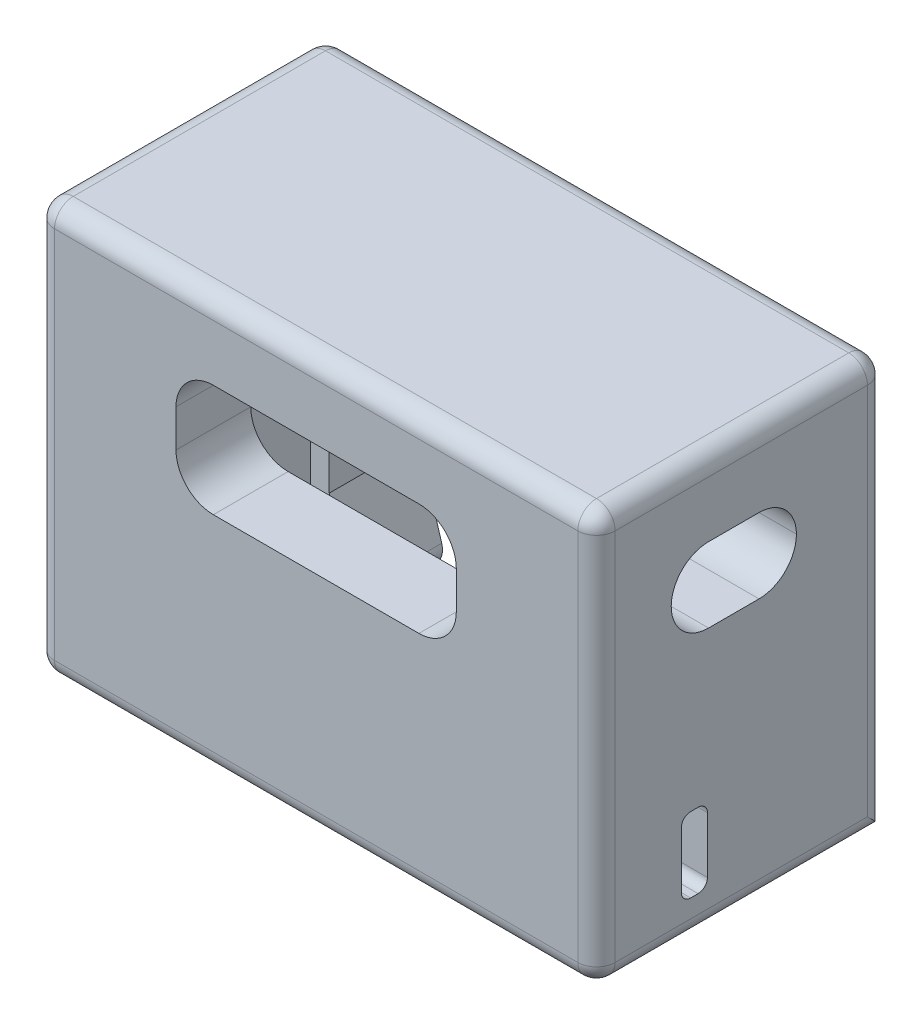
from build123d import *

# Parameters (mm, degrees)
SKETCH1_W           = 38.1
SKETCH1_H           = 6.096
BOSS_EXTRUDE1_DEPTH = 22.86
SKETCH4_W           = 25.4
SKETCH4_H           = 6.096
CUT_EXTRUDE1_DEPTH  = 15.875
FILLET1_R           = 1.27
SKETCH5_W           = 38.1
SKETCH5_H           = 19.685
BOSS_EXTRUDE2_DEPTH = 5.08
BOSS_EXTRUDE3_DEPTH = 6.096
BOSS_EXTRUDE4_DEPTH = 6.096
FILLET2_R           = 1.27
SKETCH9_W           = 38.1
SKETCH9_H           = 5.08
BOSS_EXTRUDE5_DEPTH = 22.86
SKETCH10_W          = 8.509
SKETCH10_H          = 17.78
BOSS_EXTRUDE6_DEPTH = 5.08
SKETCH11_W          = 8.509
SKETCH11_H          = 17.78
BOSS_EXTRUDE7_DEPTH = 5.08
SKETCH12_W          = 19.05
SKETCH12_H          = 7.62
CUT_EXTRUDE2_DEPTH  = 5.08
FILLET3_R           = 2.54
FILLET5_R           = 2.54
FILLET6_R           = 1.27
SKETCH13_W          = 13.940844751
SKETCH13_H          = 3.429
BOSS_EXTRUDE8_DEPTH = 1.524
CUT_EXTRUDE5_REACH  = 52.09
SKETCH22_W          = 1.778
SKETCH22_H          = 5.08
FILLET7_R           = 0.635


with BuildPart() as part:
    # Sketch1 → Boss-Extrude1 (new body)
    with BuildSketch(Plane(origin=(0, 0, 0), x_dir=(1, 0, 0), z_dir=(0, 1, 0))):
        Rectangle(SKETCH1_W, SKETCH1_H)
    extrude(amount=BOSS_EXTRUDE1_DEPTH)

    # Sketch4 → Cut-Extrude1 (cut)
    with BuildSketch(Plane.XZ):
        Rectangle(SKETCH4_W, SKETCH4_H)
    extrude(amount=-CUT_EXTRUDE1_DEPTH, mode=Mode.SUBTRACT)

    # Fillet1
    fillet1_edges = [part.edges().sort_by_distance(p)[0] for p in [
        (0, 15.875, -3.048),
    ]]
    fillet(fillet1_edges, radius=FILLET1_R)

    # Sketch5 → Boss-Extrude2 (add)
    with BuildSketch(Plane(origin=(0, 22.86, 0), x_dir=(1, 0, 0), z_dir=(0, 1, 0))):
        with Locations((0, -6.7945)):
            Rectangle(SKETCH5_W, SKETCH5_H)
    extrude(amount=BOSS_EXTRUDE2_DEPTH)

    # Sketch6 → Boss-Extrude3 (add)
    with BuildSketch(Plane.XY.offset(3.048)):
        Polygon((-12.7, 0), (-10.668, 0), (-12.7, 6.858), align=None)
    extrude(amount=-BOSS_EXTRUDE3_DEPTH)

    # Sketch7 → Boss-Extrude4 (add)
    with BuildSketch(Plane.XY.offset(3.048)):
        Polygon((12.7, 0), (10.668, 0), (12.7, 6.858), align=None)
    extrude(amount=-BOSS_EXTRUDE4_DEPTH)

    # Fillet2
    fillet2_edges = [part.edges().sort_by_distance(p)[0] for p in [
        (-10.668, 0, 0),
        (10.668, 0, 0),
    ]]
    fillet(fillet2_edges, radius=FILLET2_R)

    # Sketch9 → Boss-Extrude5 (add)
    with BuildSketch(Plane.XZ.offset(-22.86)):
        with Locations((0, 14.097)):
            Rectangle(SKETCH9_W, SKETCH9_H)
    extrude(amount=BOSS_EXTRUDE5_DEPTH)

    # Sketch10 → Boss-Extrude6 (add)
    with BuildSketch(Plane(origin=(19.05, 0, 0), x_dir=(0, 0, -1), z_dir=(1, 0, 0))):
        with Locations((-7.3025, 8.89)):
            Rectangle(SKETCH10_W, SKETCH10_H)
    extrude(amount=-BOSS_EXTRUDE6_DEPTH)

    # Sketch11 → Boss-Extrude7 (add)
    with BuildSketch(Plane.ZY.offset(19.05)):
        with Locations((7.3025, 8.89)):
            Rectangle(SKETCH11_W, SKETCH11_H)
    extrude(amount=-BOSS_EXTRUDE7_DEPTH)

    # Sketch12 → Cut-Extrude2 (cut)
    with BuildSketch(Plane.XY.offset(16.637)):
        with Locations((0, 19.05)):
            Rectangle(SKETCH12_W, SKETCH12_H)
    extrude(amount=-CUT_EXTRUDE2_DEPTH, mode=Mode.SUBTRACT)

    # Fillet3
    fillet3_edges = [part.edges().sort_by_distance(p)[0] for p in [
        (9.525, 22.86, 14.097),
        (9.525, 15.24, 14.097),
        (-9.525, 15.24, 14.097),
        (-9.525, 22.86, 14.097),
    ]]
    fillet(fillet3_edges, radius=FILLET3_R)

    # Fillet5
    fillet5_edges = [part.edges().sort_by_distance(p)[0] for p in [
        (13.0175, 22.86, 11.557),
        (16.51, 17.78, 11.557),
        (16.51, 17.78, 3.048),
        (0, 22.86, 3.048),
        (-13.0175, 22.86, 11.557),
        (-16.51, 17.78, 11.557),
        (-16.51, 17.78, 3.048),
    ]]
    fillet(fillet5_edges, radius=FILLET5_R - 0.0001)  # a hair under: the kernel refuses the full size

    # Fillet6
    fillet6_edges = [part.edges().sort_by_distance(p)[0] for p in [
        (19.05, 13.97, 16.637),
        (-19.05, 13.97, 16.637),
        (19.05, 27.94, 6.7945),
        (0, 27.94, -3.048),
        (-19.05, 27.94, 6.7945),
        (0, 27.94, 16.637),
        (-19.05, 0, 6.7945),
        (19.05, 0, 6.7945),
        (-19.05, 13.97, -3.048),
        (19.05, 13.97, -3.048),
        (0, 0, 16.637),
    ]]
    fillet(fillet6_edges, radius=FILLET6_R)

    # Sketch13 → Boss-Extrude8 (add)
    with BuildSketch(Plane.XZ.offset(-22.86)):
        with Locations((-0.014577624, 7.3025)):
            Rectangle(SKETCH13_W, SKETCH13_H)
    extrude(amount=BOSS_EXTRUDE8_DEPTH)

    # Cut-Extrude5: up to this face of the body (flat: up to its plane)
    cut_extrude5_end = Plane(part.part.faces().sort_by_distance((-19.05, 13.368385641, 6.746370851))[0])
    # Sketch22 → Cut-Extrude5 (cut, up to the picked face)
    with BuildSketch(Plane(origin=(19.05, 0, 0), x_dir=(0, 0, -1), z_dir=(1, 0, 0)), mode=Mode.PRIVATE) as cut_extrude5_sk1:
        with Locations((-9.982963742, 5.043439789)):
            Rectangle(SKETCH22_W, SKETCH22_H)
    cut_extrude5_tool1 = split(extrude(cut_extrude5_sk1.sketch, amount=-CUT_EXTRUDE5_REACH, mode=Mode.PRIVATE), bisect_by=cut_extrude5_end, keep=Keep.BOTH, mode=Mode.PRIVATE)
    add(cut_extrude5_tool1.solids().sort_by(Axis((19.05, 5.04344, 9.982964), (-1, 0, 0)))[0], mode=Mode.SUBTRACT)

    # Fillet7
    fillet7_edges = [part.edges().sort_by_distance(p)[0] for p in [
        (16.51, 2.503439789, 10.871963742),
        (16.51, 7.583439789, 10.871963742),
        (16.51, 7.583439789, 9.093963742),
        (16.51, 2.503439789, 9.093963742),
        (-16.51, 2.503439789, 10.871963742),
        (-16.51, 7.583439789, 10.871963742),
        (-16.51, 7.583439789, 9.093963742),
        (-16.51, 2.503439789, 9.093963742),
    ]]
    fillet(fillet7_edges, radius=FILLET7_R)


solid = part.part
